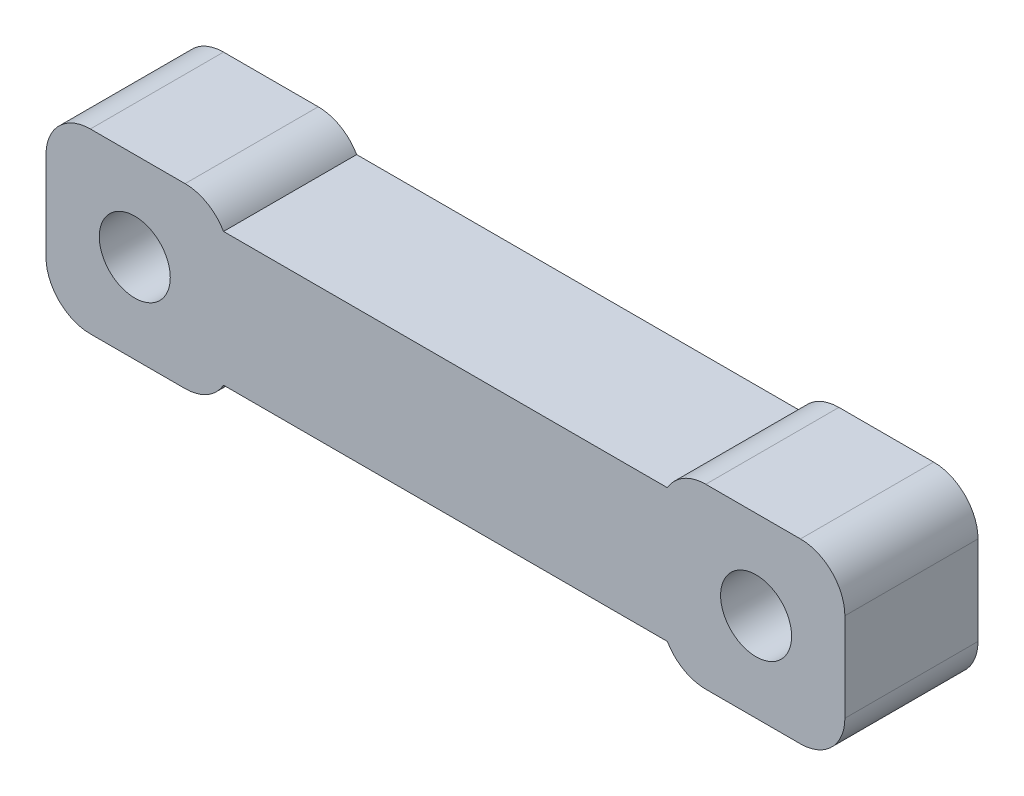
from build123d import *

# Parameters (mm, degrees)
SKETCH1_R           = 0.8
BOSS_EXTRUDE1_DEPTH = 3
FILLET1_R           = 1


with BuildPart() as part:
    # Sketch1 → Boss-Extrude1 (new body)
    with BuildSketch(Plane.XY):
        Polygon((5, -2), (9, -2), (9, 2), (5, 2), (5, 1.5), (-5, 1.5), (-5, 2), (-9, 2), (-9, -2), (-5, -2), (-5, -1.5), (5, -1.5), align=None)
        with Locations((-7, 0)):
            Circle(SKETCH1_R, mode=Mode.SUBTRACT)
        with Locations((7, 0)):
            Circle(SKETCH1_R, mode=Mode.SUBTRACT)
    extrude(amount=BOSS_EXTRUDE1_DEPTH)

    # Fillet1
    # the kernel refuses this fillet: 1 mm, written as the material it takes off along each edge
    with BuildSketch(Plane(origin=(5, -2, -2.165063509), x_dir=(1, 0, 0), z_dir=(0, 0, 1))) as fillet1_piece_1:
        with BuildLine():
            CenterArc((0.866025404, 1), FILLET1_R, 210, 60)
            Line((0, 0.5), (-0.017320508, 0.49))
            ThreePointArc((-0.017320508, 0.49), (-0.02, 0.25), (-0.02, 0))
            Line((-0.02, 0), (0, -0.02))
            Line((0, -0.02), (0.866025404, -0.02))
            Line((0.866025404, -0.02), (0.866025404, 0))
        make_face()
    extrude(amount=7.330127019, mode=Mode.SUBTRACT)
    with BuildSketch(Plane(origin=(9, -2, -2.5), x_dir=(-1, 0, 0), z_dir=(0, 0, 1)), Plane(origin=(9, 2, -2.5), x_dir=(0, -1, 0), z_dir=(0, 0, 1)), Plane(origin=(-9, -2, -2.5), x_dir=(0, 1, 0), z_dir=(0, 0, 1)), Plane(origin=(-9, 2, -2.5), x_dir=(1, 0, 0), z_dir=(0, 0, 1))) as fillet1_piece_2:
        with BuildLine():
            CenterArc((FILLET1_R, -FILLET1_R), FILLET1_R, 90, 90)
            Line((0, -FILLET1_R), (-FILLET1_R * 0.02, -FILLET1_R))
            Line((-FILLET1_R * 0.02, -FILLET1_R), (-FILLET1_R * 0.02, FILLET1_R * 0.02))
            Line((-FILLET1_R * 0.02, FILLET1_R * 0.02), (FILLET1_R, FILLET1_R * 0.02))
            Line((FILLET1_R, FILLET1_R * 0.02), (FILLET1_R, 0))
        make_face()
    extrude(amount=8, mode=Mode.SUBTRACT)
    with BuildSketch(Plane(origin=(5, 2, -2.165063509), x_dir=(1, 0, 0), z_dir=(0, 0, 1)), Plane(origin=(-5, -2, -2.165063509), x_dir=(-1, 0, 0), z_dir=(0, 0, 1))) as fillet1_piece_3:
        with BuildLine():
            CenterArc((0.866025404, -1), FILLET1_R, 90, 60)
            Line((0, -0.5), (-0.017320508, -0.49))
            ThreePointArc((-0.017320508, -0.49), (-0.02, -0.25), (-0.02, 0))
            Line((-0.02, 0), (0, 0.02))
            Line((0, 0.02), (0.866025404, 0.02))
            Line((0.866025404, 0.02), (0.866025404, 0))
        make_face()
    extrude(amount=7.330127019, mode=Mode.SUBTRACT)
    with BuildSketch(Plane(origin=(-5, 2, -2.165063509), x_dir=(0, -1, 0), z_dir=(0, 0, 1))) as fillet1_piece_4:
        with BuildLine():
            CenterArc((1, -0.866025404), FILLET1_R, 120, 60)
            Line((0, -0.866025404), (-0.02, -0.866025404))
            Line((-0.02, -0.866025404), (-0.02, 0))
            Line((-0.02, 0), (0, 0.02))
            ThreePointArc((0, 0.02), (0.25, 0.02), (0.49, 0.017320508))
            Line((0.49, 0.017320508), (0.5, 0))
        make_face()
    extrude(amount=7.330127019, mode=Mode.SUBTRACT)


solid = part.part
